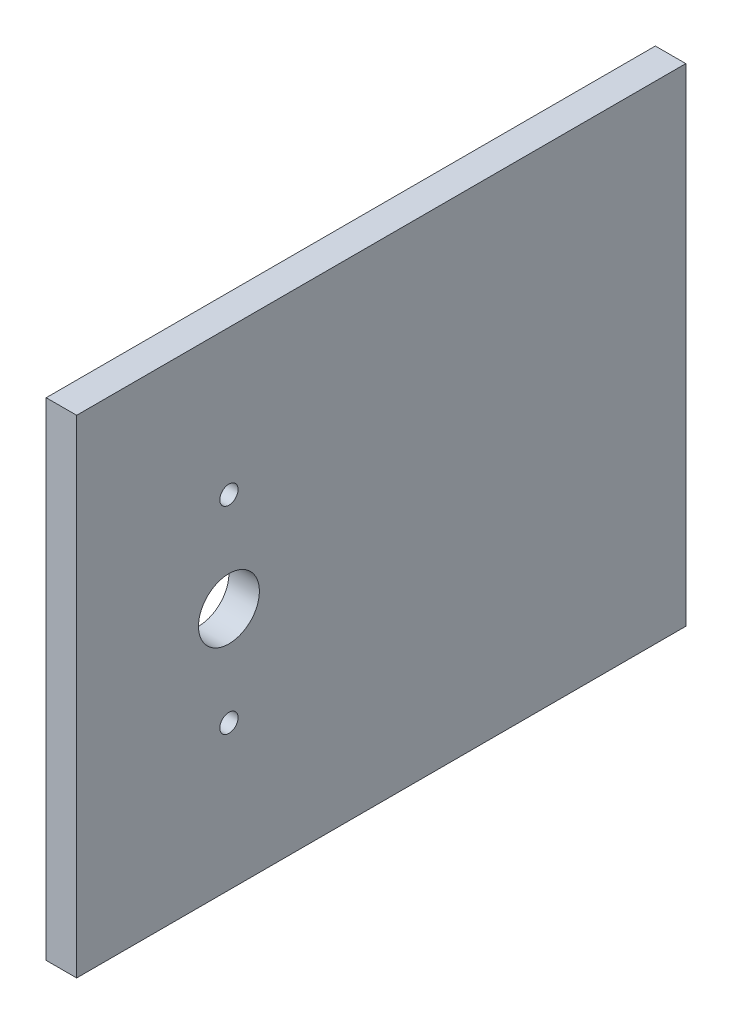
from build123d import *

# Parameters (mm, degrees)
SKETCH1_W           = 80
SKETCH1_H           = 100
SKETCH1_R           = 5
SKETCH1_R_2         = 1.5
BOSS_EXTRUDE1_DEPTH = 5


with BuildPart() as part:
    # Sketch1 → Boss-Extrude1 (new body)
    with BuildSketch(Plane.YZ):
        Rectangle(SKETCH1_W, SKETCH1_H)
        with Locations((0, 25)):
            Circle(SKETCH1_R, mode=Mode.SUBTRACT)
        with Locations((-16.22, 25)):
            Circle(SKETCH1_R_2, mode=Mode.SUBTRACT)
        with Locations((16.22, 25)):
            Circle(SKETCH1_R_2, mode=Mode.SUBTRACT)
    extrude(amount=BOSS_EXTRUDE1_DEPTH)


solid = part.part
